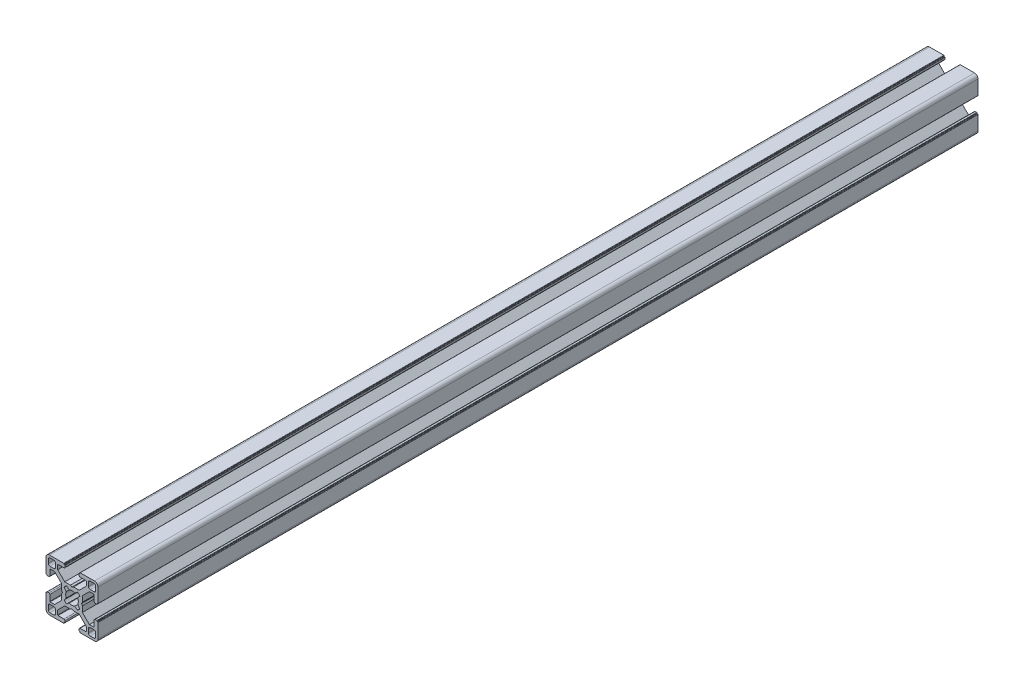
from build123d import *

# Parameters (mm, degrees)
BOSS_EXTRUDE1_DEPTH = 508


with BuildPart() as part:
    # Sketch1 → Boss-Extrude1 (new body)
    with BuildSketch(Plane.XY):
        with BuildLine():
            Line((6.00446543, 0.899999619), (5.484852164, 0))
            Line((5.484852164, 0), (6.00446543, -0.899999619))
            Line((6.00446543, -0.899999619), (6.00446543, -4.204465866))
            Line((6.00446543, -4.204465866), (10.049999564, -8.25))
            Line((10.049999564, -8.25), (12.59999928, -8.25))
            ThreePointArc((12.59999928, -8.25), (12.741420837, -8.191421273), (12.799999564, -8.049999716))
            Line((12.799999564, -8.049999716), (12.799999564, -4.649999613))
            ThreePointArc((12.799999564, -4.649999613), (12.975735606, -4.225735278), (13.39999994, -4.049999237))
            Line((13.39999994, -4.049999237), (14.300000043, -4.049999237))
            ThreePointArc((14.300000043, -4.049999237), (14.4414216, -4.108577964), (14.500000327, -4.249999521))
            Line((14.500000327, -4.249999521), (14.500000327, -4.349998953))
            ThreePointArc((14.500000327, -4.349998953), (14.558579054, -4.49142051), (14.700000611, -4.549999237))
            Line((14.700000611, -4.549999237), (14.799999716, -4.549999237))
            ThreePointArc((14.799999716, -4.549999237), (14.941421273, -4.608577964), (15, -4.749999521))
            Line((15, -4.749999521), (15, -13.000000346))
            ThreePointArc((15, -13.000000346), (14.414213664, -14.414213664), (13.000000346, -15))
            Line((13.000000346, -15), (4.749999945, -15))
            ThreePointArc((4.749999945, -15), (4.60857832, -14.941421245), (4.549999564, -14.799999619))
            Line((4.549999564, -14.799999619), (4.549999564, -14.69999942))
            ThreePointArc((4.549999564, -14.69999942), (4.49142109, -14.558578474), (4.350000144, -14.5))
            Line((4.350000144, -14.5), (4.250000374, -14.5))
            ThreePointArc((4.250000374, -14.5), (4.108578753, -14.441421247), (4.05, -14.299999626))
            Line((4.05, -14.299999626), (4.05, -13.399999434))
            ThreePointArc((4.05, -13.399999434), (4.225735989, -12.975735226), (4.650000197, -12.799999237))
            Line((4.650000197, -12.799999237), (8.049999924, -12.799999237))
            ThreePointArc((8.049999924, -12.799999237), (8.191421565, -12.741420475), (8.250000327, -12.599998834))
            Line((8.250000327, -12.599998834), (8.250000327, -10.049999237))
            Line((8.250000327, -10.049999237), (4.204466193, -6))
            Line((4.204466193, -6), (0.899999946, -6))
            Line((0.899999946, -6), (0, -5.484851837))
            Line((0, -5.484851837), (-0.899999946, -6))
            Line((-0.899999946, -6), (-4.204466193, -6))
            Line((-4.204466193, -6), (-8.250000327, -10.049999237))
            Line((-8.250000327, -10.049999237), (-8.250000327, -12.599998834))
            ThreePointArc((-8.250000327, -12.599998834), (-8.191421565, -12.741420475), (-8.049999924, -12.799999237))
            Line((-8.049999924, -12.799999237), (-4.650000197, -12.799999237))
            ThreePointArc((-4.650000197, -12.799999237), (-4.225735989, -12.975735226), (-4.05, -13.399999434))
            Line((-4.05, -13.399999434), (-4.05, -14.299999626))
            ThreePointArc((-4.05, -14.299999626), (-4.108578753, -14.441421247), (-4.250000374, -14.5))
            Line((-4.250000374, -14.5), (-4.350000144, -14.5))
            ThreePointArc((-4.350000144, -14.5), (-4.49142109, -14.558578474), (-4.549999564, -14.69999942))
            Line((-4.549999564, -14.69999942), (-4.549999564, -14.799999619))
            ThreePointArc((-4.549999564, -14.799999619), (-4.60857832, -14.941421245), (-4.749999945, -15))
            Line((-4.749999945, -15), (-13.000000346, -15))
            ThreePointArc((-13.000000346, -15), (-14.414213664, -14.414213664), (-15, -13.000000346))
            Line((-15, -13.000000346), (-15, -4.749999521))
            ThreePointArc((-15, -4.749999521), (-14.941421273, -4.608577964), (-14.799999716, -4.549999237))
            Line((-14.799999716, -4.549999237), (-14.700000611, -4.549999237))
            ThreePointArc((-14.700000611, -4.549999237), (-14.558579054, -4.49142051), (-14.500000327, -4.349998953))
            Line((-14.500000327, -4.349998953), (-14.500000327, -4.249999521))
            ThreePointArc((-14.500000327, -4.249999521), (-14.4414216, -4.108577964), (-14.300000043, -4.049999237))
            Line((-14.300000043, -4.049999237), (-13.39999994, -4.049999237))
            ThreePointArc((-13.39999994, -4.049999237), (-12.975735606, -4.225735278), (-12.799999564, -4.649999613))
            Line((-12.799999564, -4.649999613), (-12.799999564, -8.049999716))
            ThreePointArc((-12.799999564, -8.049999716), (-12.741420837, -8.191421273), (-12.59999928, -8.25))
            Line((-12.59999928, -8.25), (-10.049999564, -8.25))
            Line((-10.049999564, -8.25), (-6.00446543, -4.204465866))
            Line((-6.00446543, -4.204465866), (-6.00446543, -0.899999619))
            Line((-6.00446543, -0.899999619), (-5.484852164, 0))
            Line((-5.484852164, 0), (-6.00446543, 0.899999619))
            Line((-6.00446543, 0.899999619), (-6.00446543, 4.204465866))
            Line((-6.00446543, 4.204465866), (-10.049999564, 8.25))
            Line((-10.049999564, 8.25), (-12.59999928, 8.25))
            ThreePointArc((-12.59999928, 8.25), (-12.741420837, 8.191421273), (-12.799999564, 8.049999716))
            Line((-12.799999564, 8.049999716), (-12.799999564, 4.649999613))
            ThreePointArc((-12.799999564, 4.649999613), (-12.975735606, 4.225735278), (-13.39999994, 4.049999237))
            Line((-13.39999994, 4.049999237), (-14.300000043, 4.049999237))
            ThreePointArc((-14.300000043, 4.049999237), (-14.4414216, 4.108577964), (-14.500000327, 4.249999521))
            Line((-14.500000327, 4.249999521), (-14.500000327, 4.349998953))
            ThreePointArc((-14.500000327, 4.349998953), (-14.558579054, 4.49142051), (-14.700000611, 4.549999237))
            Line((-14.700000611, 4.549999237), (-14.799999716, 4.549999237))
            ThreePointArc((-14.799999716, 4.549999237), (-14.941421273, 4.608577964), (-15, 4.749999521))
            Line((-15, 4.749999521), (-15, 13.000000346))
            ThreePointArc((-15, 13.000000346), (-14.414213664, 14.414213664), (-13.000000346, 15))
            Line((-13.000000346, 15), (-4.749999945, 15))
            ThreePointArc((-4.749999945, 15), (-4.60857832, 14.941421245), (-4.549999564, 14.799999619))
            Line((-4.549999564, 14.799999619), (-4.549999564, 14.69999942))
            ThreePointArc((-4.549999564, 14.69999942), (-4.49142109, 14.558578474), (-4.350000144, 14.5))
            Line((-4.350000144, 14.5), (-4.250000374, 14.5))
            ThreePointArc((-4.250000374, 14.5), (-4.108578753, 14.441421247), (-4.05, 14.299999626))
            Line((-4.05, 14.299999626), (-4.05, 13.399999434))
            ThreePointArc((-4.05, 13.399999434), (-4.225735989, 12.975735226), (-4.650000197, 12.799999237))
            Line((-4.650000197, 12.799999237), (-8.049999924, 12.799999237))
            ThreePointArc((-8.049999924, 12.799999237), (-8.191421565, 12.741420475), (-8.250000327, 12.599998834))
            Line((-8.250000327, 12.599998834), (-8.250000327, 10.049999237))
            Line((-8.250000327, 10.049999237), (-4.204466193, 6))
            Line((-4.204466193, 6), (-0.899999946, 6))
            Line((-0.899999946, 6), (0, 5.484851837))
            Line((0, 5.484851837), (0.899999946, 6))
            Line((0.899999946, 6), (4.204466193, 6))
            Line((4.204466193, 6), (8.250000327, 10.049999237))
            Line((8.250000327, 10.049999237), (8.250000327, 12.599998834))
            ThreePointArc((8.250000327, 12.599998834), (8.191421565, 12.741420475), (8.049999924, 12.799999237))
            Line((8.049999924, 12.799999237), (4.650000197, 12.799999237))
            ThreePointArc((4.650000197, 12.799999237), (4.225735989, 12.975735226), (4.05, 13.399999434))
            Line((4.05, 13.399999434), (4.05, 14.299999626))
            ThreePointArc((4.05, 14.299999626), (4.108578753, 14.441421247), (4.250000374, 14.5))
            Line((4.250000374, 14.5), (4.350000144, 14.5))
            ThreePointArc((4.350000144, 14.5), (4.49142109, 14.558578474), (4.549999564, 14.69999942))
            Line((4.549999564, 14.69999942), (4.549999564, 14.799999619))
            ThreePointArc((4.549999564, 14.799999619), (4.60857832, 14.941421245), (4.749999945, 15))
            Line((4.749999945, 15), (13.000000346, 15))
            ThreePointArc((13.000000346, 15), (14.414213664, 14.414213664), (15, 13.000000346))
            Line((15, 13.000000346), (15, 4.749999521))
            ThreePointArc((15, 4.749999521), (14.941421273, 4.608577964), (14.799999716, 4.549999237))
            Line((14.799999716, 4.549999237), (14.700000611, 4.549999237))
            ThreePointArc((14.700000611, 4.549999237), (14.558579054, 4.49142051), (14.500000327, 4.349998953))
            Line((14.500000327, 4.349998953), (14.500000327, 4.249999521))
            ThreePointArc((14.500000327, 4.249999521), (14.4414216, 4.108577964), (14.300000043, 4.049999237))
            Line((14.300000043, 4.049999237), (13.39999994, 4.049999237))
            ThreePointArc((13.39999994, 4.049999237), (12.975735606, 4.225735278), (12.799999564, 4.649999613))
            Line((12.799999564, 4.649999613), (12.799999564, 8.049999716))
            ThreePointArc((12.799999564, 8.049999716), (12.741420837, 8.191421273), (12.59999928, 8.25))
            Line((12.59999928, 8.25), (10.049999564, 8.25))
            Line((10.049999564, 8.25), (6.00446543, 4.204465866))
            Line((6.00446543, 4.204465866), (6.00446543, 0.899999619))
        make_face()
        with BuildLine():
            Line((13.70000109, 12.700000398), (13.70000109, 10.499999635))
            ThreePointArc((13.70000109, 10.499999635), (13.407107874, 9.792892851), (12.70000109, 9.499999635))
            Line((12.70000109, 9.499999635), (10.500000327, 9.499999635))
            ThreePointArc((10.500000327, 9.499999635), (9.792893543, 9.792892851), (9.500000327, 10.499999635))
            Line((9.500000327, 10.499999635), (9.500000327, 12.700000398))
            ThreePointArc((9.500000327, 12.700000398), (9.792893543, 13.407107182), (10.500000327, 13.700000398))
            Line((10.500000327, 13.700000398), (12.70000109, 13.700000398))
            ThreePointArc((12.70000109, 13.700000398), (13.407107874, 13.407107182), (13.70000109, 12.700000398))
        make_face(mode=Mode.SUBTRACT)
        with BuildLine():
            Line((3.135929412, 4.518400903), (1.600129524, 3.280561767))
            ThreePointArc((1.600129524, 3.280561767), (0, 3.65), (-1.600129524, 3.280561767))
            Line((-1.600129524, 3.280561767), (-3.135929412, 4.518400903))
            ThreePointArc((-3.135929412, 4.518400903), (-3.881002259, 3.897155561), (-4.505336892, 3.154669473))
            Line((-4.505336892, 3.154669473), (-3.280561732, 1.600129597))
            ThreePointArc((-3.280561732, 1.600129597), (-3.65, 0), (-3.280561732, -1.600129597))
            Line((-3.280561732, -1.600129597), (-4.505336892, -3.154669473))
            ThreePointArc((-4.505336892, -3.154669473), (-3.881002259, -3.897155561), (-3.135929412, -4.518400903))
            Line((-3.135929412, -4.518400903), (-1.600129524, -3.280561767))
            ThreePointArc((-1.600129524, -3.280561767), (0, -3.65), (1.600129524, -3.280561767))
            Line((1.600129524, -3.280561767), (3.135929412, -4.518400903))
            ThreePointArc((3.135929412, -4.518400903), (3.881002259, -3.897155561), (4.505336892, -3.154669473))
            Line((4.505336892, -3.154669473), (3.280561732, -1.600129597))
            ThreePointArc((3.280561732, -1.600129597), (3.65, 0), (3.280561732, 1.600129597))
            Line((3.280561732, 1.600129597), (4.505336892, 3.154669473))
            ThreePointArc((4.505336892, 3.154669473), (3.881002259, 3.897155561), (3.135929412, 4.518400903))
        make_face(mode=Mode.SUBTRACT)
        with BuildLine():
            Line((-13.70000109, -12.700000398), (-13.70000109, -10.499999635))
            ThreePointArc((-13.70000109, -10.499999635), (-13.407107874, -9.792892851), (-12.70000109, -9.499999635))
            Line((-12.70000109, -9.499999635), (-10.500000327, -9.499999635))
            ThreePointArc((-10.500000327, -9.499999635), (-9.792893543, -9.792892851), (-9.500000327, -10.499999635))
            Line((-9.500000327, -10.499999635), (-9.500000327, -12.700000398))
            ThreePointArc((-9.500000327, -12.700000398), (-9.792893543, -13.407107182), (-10.500000327, -13.700000398))
            Line((-10.500000327, -13.700000398), (-12.70000109, -13.700000398))
            ThreePointArc((-12.70000109, -13.700000398), (-13.407107874, -13.407107182), (-13.70000109, -12.700000398))
        make_face(mode=Mode.SUBTRACT)
        with BuildLine():
            Line((10.500000327, -13.700000398), (12.70000109, -13.700000398))
            ThreePointArc((12.70000109, -13.700000398), (13.407107874, -13.407107182), (13.70000109, -12.700000398))
            Line((13.70000109, -12.700000398), (13.70000109, -10.499999635))
            ThreePointArc((13.70000109, -10.499999635), (13.407107874, -9.792892851), (12.70000109, -9.499999635))
            Line((12.70000109, -9.499999635), (10.500000327, -9.499999635))
            ThreePointArc((10.500000327, -9.499999635), (9.792893543, -9.792892851), (9.500000327, -10.499999635))
            Line((9.500000327, -10.499999635), (9.500000327, -12.700000398))
            ThreePointArc((9.500000327, -12.700000398), (9.792893543, -13.407107182), (10.500000327, -13.700000398))
        make_face(mode=Mode.SUBTRACT)
        with BuildLine():
            Line((-10.500000327, 13.700000398), (-12.70000109, 13.700000398))
            ThreePointArc((-12.70000109, 13.700000398), (-13.407107874, 13.407107182), (-13.70000109, 12.700000398))
            Line((-13.70000109, 12.700000398), (-13.70000109, 10.499999635))
            ThreePointArc((-13.70000109, 10.499999635), (-13.407107874, 9.792892851), (-12.70000109, 9.499999635))
            Line((-12.70000109, 9.499999635), (-10.500000327, 9.499999635))
            ThreePointArc((-10.500000327, 9.499999635), (-9.792893543, 9.792892851), (-9.500000327, 10.499999635))
            Line((-9.500000327, 10.499999635), (-9.500000327, 12.700000398))
            ThreePointArc((-9.500000327, 12.700000398), (-9.792893543, 13.407107182), (-10.500000327, 13.700000398))
        make_face(mode=Mode.SUBTRACT)
    extrude(amount=BOSS_EXTRUDE1_DEPTH)


solid = part.part
